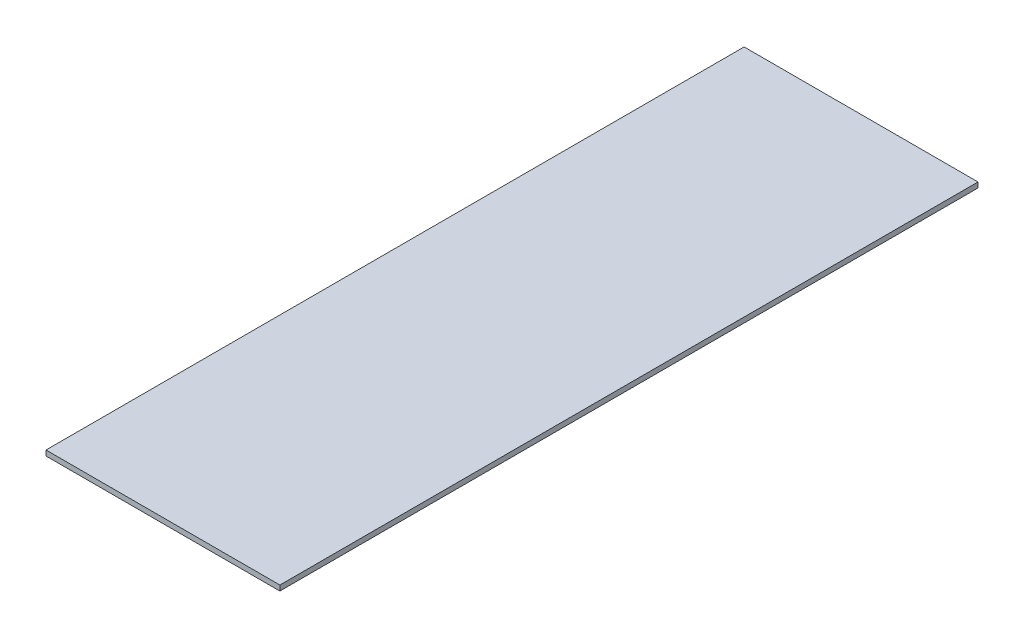
from build123d import *

# Parameters (mm, degrees)
SKETCH2_W           = 134
SKETCH2_H           = 400
BOSS_EXTRUDE1_DEPTH = 3


with BuildPart() as part:
    # Sketch2 → Boss-Extrude1 (new body)
    with BuildSketch(Plane(origin=(0, 0, 0), x_dir=(1, 0, 0), z_dir=(0, 1, 0))):
        with Locations((67, 200)):
            Rectangle(SKETCH2_W, SKETCH2_H)
    extrude(amount=BOSS_EXTRUDE1_DEPTH)


solid = part.part
